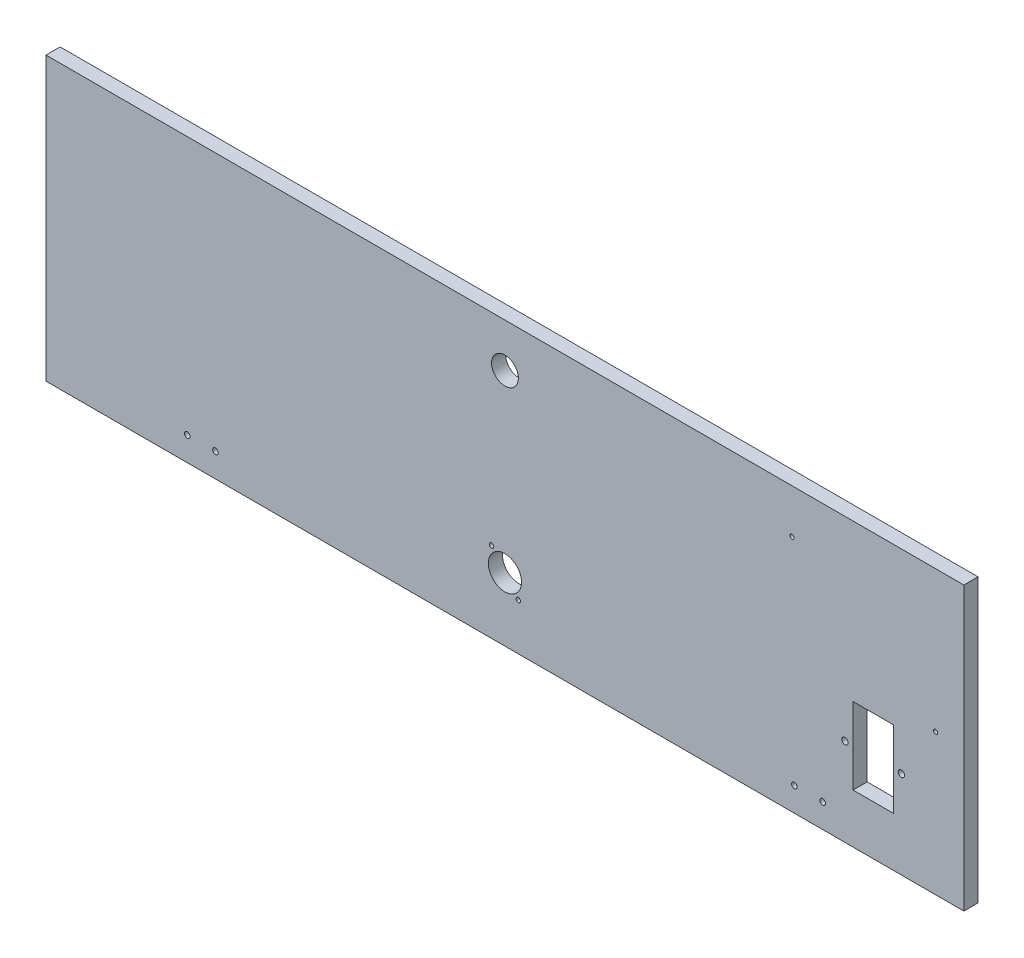
from build123d import *

# Parameters (mm, degrees)
ESQUISSE1_W             = 650
ESQUISSE1_H             = 200
BOSS_EXTRU_1_DEPTH      = 10
ESQUISSE2_R             = 2
ENL_V_MAT_EXTRU_1_DEPTH = 10
ESQUISSE3_R             = 1.6
ESQUISSE3_R_2           = 11.75
ESQUISSE3_W             = 28.5
ESQUISSE3_H             = 54.3
ESQUISSE3_R_3           = 2.25
ENL_V_MAT_EXTRU_2_DEPTH = 10
ESQUISSE4_R             = 9.5
ENL_V_MAT_EXTRU_3_DEPTH = 10
ESQUISSE5_R             = 1
ENL_V_MAT_EXTRU_4_DEPTH = 2
ESQUISSE6_R             = 1.5
ENL_V_MAT_EXTRU_5_DEPTH = 10


with BuildPart() as part:
    # Esquisse1 → Boss.-Extru.1 (new body)
    with BuildSketch(Plane.XY):
        with Locations((325, 100)):
            Rectangle(ESQUISSE1_W, ESQUISSE1_H)
    extrude(amount=BOSS_EXTRU_1_DEPTH)

    # Esquisse2 → Enlèv. mat.-Extru.1 (cut)
    with BuildSketch(Plane.XY.offset(10)):
        with Locations((100, 17)):
            Circle(ESQUISSE2_R)
        with Locations((120, 17)):
            Circle(ESQUISSE2_R)
        with Locations((530, 17)):
            Circle(ESQUISSE2_R)
        with Locations((550, 17)):
            Circle(ESQUISSE2_R)
    extrude(amount=-ENL_V_MAT_EXTRU_1_DEPTH, mode=Mode.SUBTRACT)

    # Esquisse3 → Enlèv. mat.-Extru.2 (cut)
    with BuildSketch(Plane.XY.offset(10)):
        with Locations((315.499614794, 56.999404399)):
            Circle(ESQUISSE3_R)
        with Locations((325, 45)):
            Circle(ESQUISSE3_R_2)
        with Locations((334.500385206, 33.000595601)):
            Circle(ESQUISSE3_R)
        with Locations((585.75, 62.15)):
            Rectangle(ESQUISSE3_W, ESQUISSE3_H)
        with Locations((565.75, 62.15)):
            Circle(ESQUISSE3_R_3)
        with Locations((605.75, 62.15)):
            Circle(ESQUISSE3_R_3)
    extrude(amount=-ENL_V_MAT_EXTRU_2_DEPTH, mode=Mode.SUBTRACT)

    # Esquisse4 → Enlèv. mat.-Extru.3 (cut)
    with BuildSketch(Plane.XY.offset(10)):
        with Locations((325, 169)):
            Circle(ESQUISSE4_R)
    extrude(amount=-ENL_V_MAT_EXTRU_3_DEPTH, mode=Mode.SUBTRACT)

    # Esquisse5 → Enlèv. mat.-Extru.4 (cut)
    with BuildSketch(Plane.XY):
        with Locations((341, 169)):
            Circle(ESQUISSE5_R)
        with Locations((309, 169)):
            Circle(ESQUISSE5_R)
        with Locations((125, 193)):
            Circle(ESQUISSE5_R)
        with Locations((105, 193)):
            Circle(ESQUISSE5_R)
        with Locations((545, 193)):
            Circle(ESQUISSE5_R)
        with Locations((525, 193)):
            Circle(ESQUISSE5_R)
    extrude(amount=ENL_V_MAT_EXTRU_4_DEPTH, mode=Mode.SUBTRACT)

    # Esquisse6 → Enlèv. mat.-Extru.5 (cut)
    with BuildSketch(Plane(origin=(0, 0, 0), x_dir=(-1, 0, 0), z_dir=(0, 0, -1))):
        with Locations((-528.25, 168.75)):
            Circle(ESQUISSE6_R)
        with Locations((-630, 100)):
            Circle(ESQUISSE6_R)
    extrude(amount=-ENL_V_MAT_EXTRU_5_DEPTH, mode=Mode.SUBTRACT)


solid = part.part
